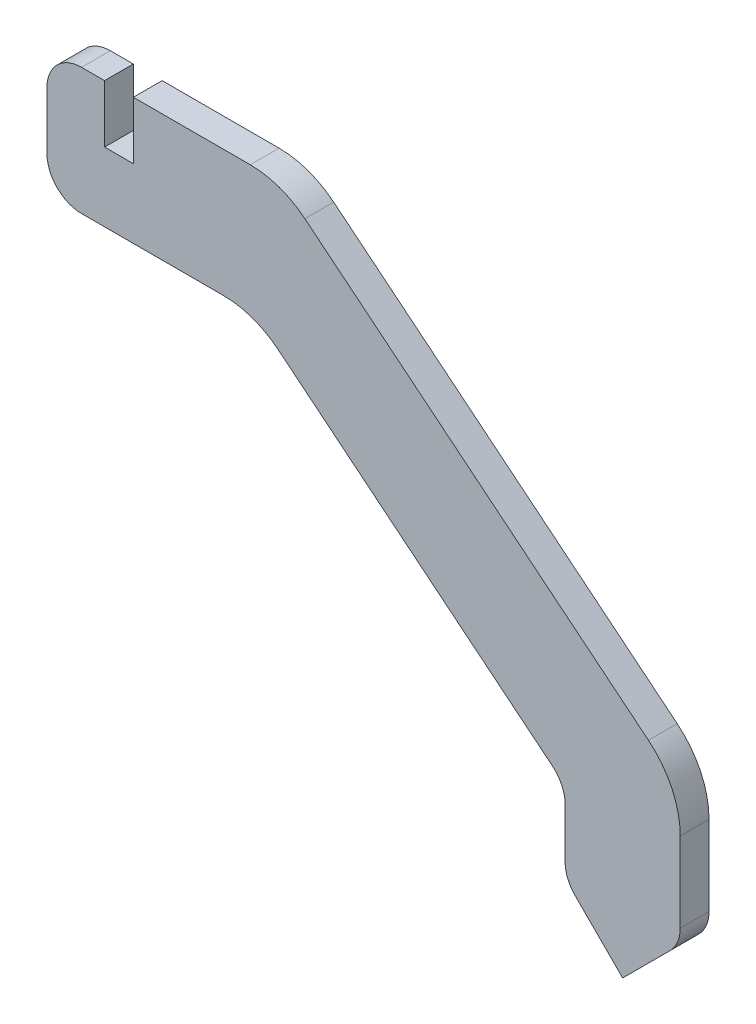
from build123d import *

# Parameters (mm, degrees)
BOSS_EXTRUDE1_DEPTH = 0.125
FILLET1_R           = 0.3
FILLET2_R           = 0.75


with BuildPart() as part:
    # frame_outline → Boss-Extrude1 (new, symmetric)
    with BuildSketch(Plane.XY):
        Polygon((0, 0), (0, 1.1), (0.5, 1.1), (0.5, 0.6), (0.75, 0.6), (0.75, 1.1), (2.033097706, 1.1), (5.5, -1.724883351), (5.5, -2.9), (5, -3.4), (4.5, -2.9), (4.5, -2.2), (1.8, 0), align=None)
    extrude(amount=BOSS_EXTRUDE1_DEPTH, both=True)

    # Fillet1
    fillet1_edges = [part.edges().sort_by_distance(p)[0] for p in [
        (5.5, -2.9, 0),
        (4.5, -2.9, 0),
        (0, 1.1, 0),
        (4.5, -2.2, 0),
        (0, 0, 0),
    ]]
    fillet(fillet1_edges, radius=FILLET1_R)

    # Fillet2
    fillet2_edges = [part.edges().sort_by_distance(p)[0] for p in [
        (5.5, -1.724883351, 0),
        (2.033097706, 1.1, 0),
        (1.8, 0, 0),
    ]]
    fillet(fillet2_edges, radius=FILLET2_R)


solid = part.part
